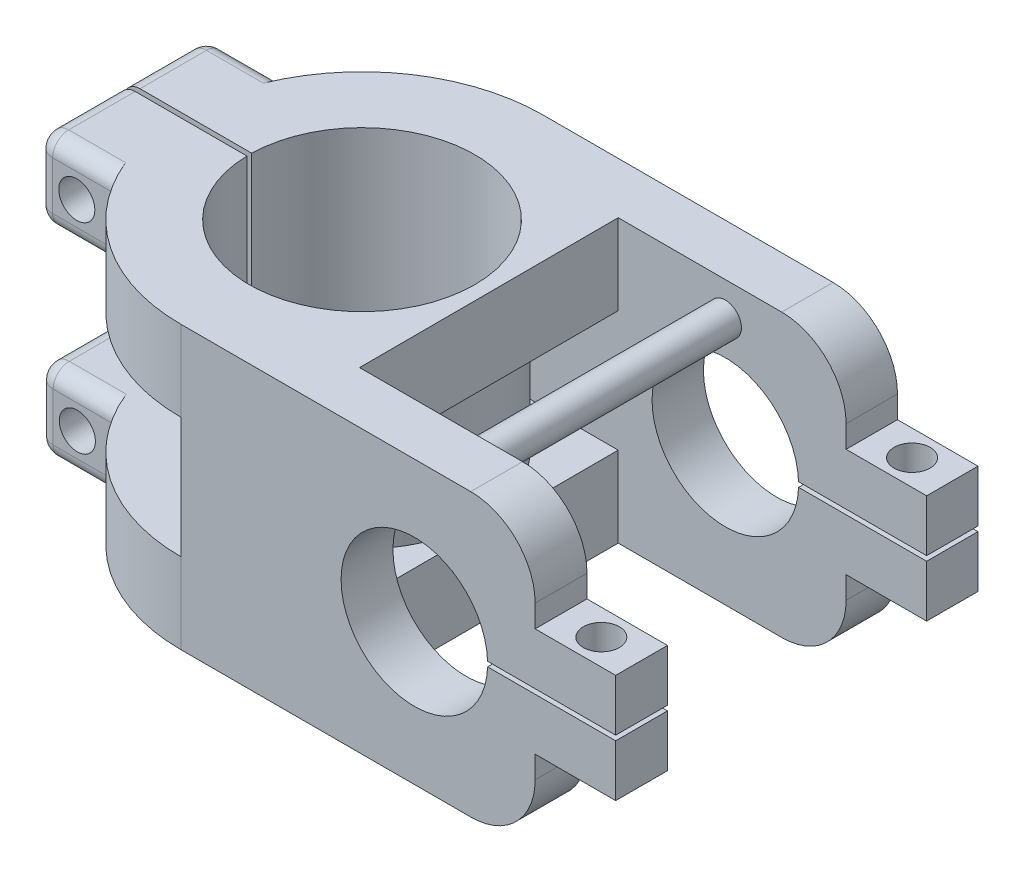
from build123d import *

# Parameters (mm, degrees)
SKETCH2_R                 = 28.575
SKETCH2_R_2               = 17.78
BOSS_EXTRUDE3_DEPTH       = 12.7
SKETCH3_W                 = 10.854473524
SKETCH3_H                 = 26.443507434
CUT_EXTRUDE1_DEPTH        = 12.7
CUT_EXTRUDE2_DEPTH        = 12.7
SKETCH5_W                 = 12.840753717
SKETCH5_H                 = 12.7
BOSS_EXTRUDE4_DEPTH       = 12.7
SKETCH6_W                 = 12.840753717
SKETCH6_H                 = 12.7
BOSS_EXTRUDE5_DEPTH       = 12.7
SKETCH7_R                 = 2.8448
CUT_EXTRUDE3_DEPTH        = 33.02
FILLET1_R                 = 2.54
FILLET2_R                 = 2.54
FILLET3_R                 = 2.54
FILLET4_R                 = 2.54
FILLET5_R                 = 2.54
FILLET6_R                 = 2.54
SKETCH8_R                 = 18.738819316
SKETCH8_R_2               = 17.78
BOSS_EXTRUDE6_DEPTH       = 19.05
SKETCH9_R                 = 28.575
BOSS_EXTRUDE7_DEPTH       = 12.7
SKETCH12_W                = 11.37566774
SKETCH12_H                = 26.806734356
CUT_EXTRUDE4_DEPTH        = 12.7
SKETCH13_W                = 26.806734356
SKETCH13_H                = 12.7
BOSS_EXTRUDE8_DEPTH       = 12.7
CUT_EXTRUDE5_START        = -12.7
SKETCH14_R                = 17.78
CUT_EXTRUDE5_DEPTH        = 12.7
CUT_EXTRUDE6_START        = -12.7
CUT_EXTRUDE6_DEPTH        = 12.7
SKETCH16_W                = 20.93971863
SKETCH16_H                = 0.381
CUT_EXTRUDE7_DEPTH        = 12.7
FILLET7_R                 = 2.54
FILLET8_R                 = 2.54
FILLET9_R                 = 2.54
FILLET10_R                = 2.54
FILLET11_R                = 2.54
FILLET12_R                = 2.54
SKETCH17_R                = 2.8448
CUT_EXTRUDE8_DEPTH        = 29.464
SKETCH19_W                = 1.827097527
SKETCH19_H                = 0.762
CUT_EXTRUDE13_DEPTH       = 29.464
BOSS_EXTRUDE12_DEPTH      = 31.75
BOSS_EXTRUDE12_DEPTH_BACK = 12.7
SKETCH22_W                = 55.88
SKETCH22_H                = 8.17709812
BOSS_EXTRUDE13_DEPTH      = 31.75
BOSS_EXTRUDE13_DEPTH_BACK = 12.7
SKETCH23_W                = 55.88
SKETCH23_H                = 8.104128776
SKETCH24_R                = 11.557
CUT_EXTRUDE14_DEPTH       = 67.31
FILLET13_R                = 10.16
FILLET14_R                = 10.16
FILLET15_R                = 10.16
FILLET16_R                = 10.16
CUT_EXTRUDE15_DEPTH       = 67.31
SKETCH26_R                = 2.54
BOSS_EXTRUDE14_DEPTH      = 43.434
SKETCH27_W                = 10.889060874
SKETCH27_H                = 0.381
CUT_EXTRUDE16_DEPTH       = 64.516
SKETCH28_W                = 8.900082699
SKETCH28_H                = 0.381
CUT_EXTRUDE17_DEPTH       = 64.516
SKETCH29_W                = 8.17709812
SKETCH29_H                = 8.1770982
BOSS_EXTRUDE15_DEPTH      = 12.7
SKETCH30_W                = 8.17709812
SKETCH30_H                = 8.1770982
BOSS_EXTRUDE16_DEPTH      = 12.7
SKETCH31_R                = 2.8448
CUT_EXTRUDE18_DEPTH       = 22.098
SKETCH34_W                = 8.104128776
SKETCH34_H                = 8.1770982
BOSS_EXTRUDE17_DEPTH      = 12.7
SKETCH35_W                = 8.104128776
SKETCH35_H                = 8.1770982
BOSS_EXTRUDE18_DEPTH      = 12.7
SKETCH36_R                = 2.8448
CUT_EXTRUDE19_DEPTH       = 27.686


with BuildPart() as part:
    # Sketch2 → Boss-Extrude3 (new body)
    with BuildSketch(Plane(origin=(0, 0, 0), x_dir=(1, 0, 0), z_dir=(0, 1, 0))):
        Circle(SKETCH2_R)
        Circle(SKETCH2_R_2, mode=Mode.SUBTRACT)
    extrude(amount=BOSS_EXTRUDE3_DEPTH)

    # Sketch3 → Cut-Extrude1 (cut)
    with BuildSketch(Plane(origin=(0, 12.7, 0), x_dir=(1, 0, 0), z_dir=(0, 1, 0))):
        with Locations((-30.759347879, 0)):
            Rectangle(SKETCH3_W, SKETCH3_H)
    extrude(amount=-CUT_EXTRUDE1_DEPTH, mode=Mode.SUBTRACT)

    # Sketch4 → Cut-Extrude2 (cut)
    with BuildSketch(Plane(origin=(0, 12.7, 0), x_dir=(1, 0, 0), z_dir=(0, 1, 0))):
        Polygon((-16.376768267, 0), (-16.376768267, 0.381), (-26.003615217, 0.381), (-26.003615217, -0.381), (-16.376768267, -0.381), align=None)
    extrude(amount=-CUT_EXTRUDE2_DEPTH, mode=Mode.SUBTRACT)

    # Sketch5 → Boss-Extrude4 (add)
    with BuildSketch(Plane.ZY.offset(25.332111117)):
        with Locations((6.801376859, 6.35)):
            Rectangle(SKETCH5_W, SKETCH5_H)
    extrude(amount=BOSS_EXTRUDE4_DEPTH)

    # Sketch6 → Boss-Extrude5 (add)
    with BuildSketch(Plane.ZY.offset(25.332111117)):
        with Locations((-6.801376859, 6.35)):
            Rectangle(SKETCH6_W, SKETCH6_H)
    extrude(amount=BOSS_EXTRUDE5_DEPTH)

    # Sketch7 → Cut-Extrude3 (cut)
    with BuildSketch(Plane.XY.offset(13.221753717)):
        with Locations((-31.682111117, 6.35)):
            Circle(SKETCH7_R)
    extrude(amount=-CUT_EXTRUDE3_DEPTH, mode=Mode.SUBTRACT)

    # Fillet1
    fillet1_edges = [part.edges().sort_by_distance(p)[0] for p in [
        (-38.032111117, 6.35, 13.221753717),
    ]]
    fillet(fillet1_edges, radius=FILLET1_R)

    # Fillet2
    fillet2_edges = [part.edges().sort_by_distance(p)[0] for p in [
        (-38.032111117, 6.35, -13.221753717),
    ]]
    fillet(fillet2_edges, radius=FILLET2_R)

    # Fillet3
    fillet3_edges = [part.edges().sort_by_distance(p)[0] for p in [
        (-30.412111117, 12.7, -13.221753717),
        (-37.288162341, 12.7, -12.477804942),
        (-38.032111117, 12.7, -5.531376859),
    ]]
    fillet(fillet3_edges, radius=FILLET3_R)

    # Fillet4
    fillet4_edges = [part.edges().sort_by_distance(p)[0] for p in [
        (-30.412111117, 12.7, 13.221753717),
        (-37.288162341, 12.7, 12.477804942),
        (-38.032111117, 12.7, 5.531376859),
    ]]
    fillet(fillet4_edges, radius=FILLET4_R)

    # Fillet5
    fillet5_edges = [part.edges().sort_by_distance(p)[0] for p in [
        (-30.412111117, 0, -13.221753717),
        (-37.288162341, 0, -12.477804942),
        (-38.032111117, 0, -5.531376859),
    ]]
    fillet(fillet5_edges, radius=FILLET5_R)

    # Fillet6
    fillet6_edges = [part.edges().sort_by_distance(p)[0] for p in [
        (-30.412111117, 0, 13.221753717),
        (-37.288162341, 0, 12.477804942),
        (-38.032111117, 0, 5.531376859),
    ]]
    fillet(fillet6_edges, radius=FILLET6_R)

    # Sketch8 → Boss-Extrude6 (add)
    with BuildSketch(Plane(origin=(0, 12.7, 0), x_dir=(1, 0, 0), z_dir=(0, 1, 0))):
        Circle(SKETCH8_R)
        Circle(SKETCH8_R_2, mode=Mode.SUBTRACT)
    extrude(amount=BOSS_EXTRUDE6_DEPTH)

    # Sketch9 → Boss-Extrude7 (add)
    with BuildSketch(Plane(origin=(0, 31.75, 0), x_dir=(1, 0, 0), z_dir=(0, 1, 0))):
        Circle(SKETCH9_R)
    extrude(amount=BOSS_EXTRUDE7_DEPTH)

    # Sketch12 → Cut-Extrude4 (cut)
    with BuildSketch(Plane(origin=(0, 44.45, 0), x_dir=(1, 0, 0), z_dir=(0, 1, 0))):
        with Locations((-30.924322796, 0)):
            Rectangle(SKETCH12_W, SKETCH12_H)
    extrude(amount=-CUT_EXTRUDE4_DEPTH, mode=Mode.SUBTRACT)

    # Sketch13 → Boss-Extrude8 (add)
    with BuildSketch(Plane.ZY.offset(25.236488926)):
        with Locations((0, 38.1)):
            Rectangle(SKETCH13_W, SKETCH13_H)
    extrude(amount=BOSS_EXTRUDE8_DEPTH)

    # Sketch14 → Cut-Extrude5 (cut)
    with BuildSketch(Plane(origin=(0, 44.45, 0), x_dir=(1, 0, 0), z_dir=(0, 1, 0)).offset(CUT_EXTRUDE5_START)):
        Circle(SKETCH14_R)
    extrude(amount=CUT_EXTRUDE5_DEPTH, mode=Mode.SUBTRACT)

    # Sketch15 → Cut-Extrude6 (cut)
    with BuildSketch(Plane(origin=(0, 44.45, 0), x_dir=(1, 0, 0), z_dir=(0, 1, 0)).offset(CUT_EXTRUDE6_START)):
        with BuildLine():
            Line((-37.936488926, 0.381), (-37.936488926, 0))
            Line((-37.936488926, 0), (-17.78, 0))
            ThreePointArc((-17.78, 0), (-17.778979318, 0.190510937), (-17.775917388, 0.381))
            Line((-17.775917388, 0.381), (-37.936488926, 0.381))
        make_face()
    extrude(amount=CUT_EXTRUDE6_DEPTH, mode=Mode.SUBTRACT)

    # Sketch16 → Cut-Extrude7 (cut)
    with BuildSketch(Plane(origin=(0, 44.45, 0), x_dir=(1, 0, 0), z_dir=(0, 1, 0))):
        with Locations((-27.466629611, -0.1905)):
            Rectangle(SKETCH16_W, SKETCH16_H)
    extrude(amount=-CUT_EXTRUDE7_DEPTH, mode=Mode.SUBTRACT)

    # Fillet7
    fillet7_edges = [part.edges().sort_by_distance(p)[0] for p in [
        (-37.936488926, 44.45, -6.892183589),
    ]]
    fillet(fillet7_edges, radius=FILLET7_R)

    # Fillet8
    fillet8_edges = [part.edges().sort_by_distance(p)[0] for p in [
        (-37.936488926, 44.45, 6.892183589),
    ]]
    fillet(fillet8_edges, radius=FILLET8_R)

    # Fillet9
    fillet9_edges = [part.edges().sort_by_distance(p)[0] for p in [
        (-37.936488926, 31.75, -6.892183589),
    ]]
    fillet(fillet9_edges, radius=FILLET9_R)

    # Fillet10
    fillet10_edges = [part.edges().sort_by_distance(p)[0] for p in [
        (-37.936488926, 31.75, 6.892183589),
    ]]
    fillet(fillet10_edges, radius=FILLET10_R)

    # Fillet11
    fillet11_edges = [part.edges().sort_by_distance(p)[0] for p in [
        (-30.316488926, 31.75, 13.403367178),
        (-37.19254015, 32.493948776, 13.403367178),
        (-30.316488926, 44.45, 13.403367178),
        (-37.19254015, 43.706051224, 13.403367178),
        (-37.936488926, 38.1, 13.403367178),
    ]]
    fillet(fillet11_edges, radius=FILLET11_R)

    # Fillet12
    fillet12_edges = [part.edges().sort_by_distance(p)[0] for p in [
        (-30.316488926, 44.45, -13.403367178),
        (-37.19254015, 43.706051224, -13.403367178),
        (-30.316488926, 31.75, -13.403367178),
        (-37.19254015, 32.493948776, -13.403367178),
        (-37.936488926, 38.1, -13.403367178),
    ]]
    fillet(fillet12_edges, radius=FILLET12_R)

    # Sketch17 → Cut-Extrude8 (cut)
    with BuildSketch(Plane.XY.offset(13.403367178)):
        with Locations((-31.586488926, 38.1)):
            Circle(SKETCH17_R)
    extrude(amount=-CUT_EXTRUDE8_DEPTH, mode=Mode.SUBTRACT)

    # Sketch19 → Cut-Extrude13 (cut)
    with BuildSketch(Plane(origin=(0, 31.75, 0), x_dir=(1, 0, 0), z_dir=(0, 1, 0))):
        with Locations((-17.821396883, 0)):
            Rectangle(SKETCH19_W, SKETCH19_H)
    extrude(amount=-CUT_EXTRUDE13_DEPTH, mode=Mode.SUBTRACT)


with BuildPart() as cut_extrude13_kept_piece:
    # of the separate pieces the step leaves, the one the design keeps (cut_extrude13_pieces_kept)
    add(part.part.solids().sort_by_distance((-35.396488926, 31.75, -10.863367178))[0])

    # Sketch22 → Boss-Extrude12 (add, two sides: drawn at the far end of the back side and taken through both)
    with BuildSketch(Plane(origin=(0, 12.7, 0), x_dir=(1, 0, 0), z_dir=(0, 1, 0)).offset(-BOSS_EXTRUDE12_DEPTH_BACK)):
        with Locations((27.94, -24.48645094)):
            Rectangle(SKETCH22_W, SKETCH22_H)
    extrude(amount=BOSS_EXTRUDE12_DEPTH + BOSS_EXTRUDE12_DEPTH_BACK)

    # Sketch23 → Boss-Extrude13 (add, two sides: drawn at the far end of the back side and taken through both)
    with BuildSketch(Plane(origin=(0, 12.7, 0), x_dir=(1, 0, 0), z_dir=(0, 1, 0)).offset(-BOSS_EXTRUDE13_DEPTH_BACK)):
        with Locations((27.94, 24.522935612)):
            Rectangle(SKETCH23_W, SKETCH23_H)
    extrude(amount=BOSS_EXTRUDE13_DEPTH + BOSS_EXTRUDE13_DEPTH_BACK)

    # Sketch24 → Cut-Extrude14 (cut)
    with BuildSketch(Plane(origin=(0, 0, -28.575), x_dir=(-1, 0, 0), z_dir=(0, 0, -1))):
        with Locations((-36.83, 22.225)):
            Circle(SKETCH24_R)
    extrude(amount=-CUT_EXTRUDE14_DEPTH, mode=Mode.SUBTRACT)

    # Fillet13
    fillet13_edges = [cut_extrude13_kept_piece.edges().sort_by_distance(p)[0] for p in [
        (55.88, 44.45, 24.48645094),
    ]]
    fillet(fillet13_edges, radius=FILLET13_R)

    # Fillet14
    fillet14_edges = [cut_extrude13_kept_piece.edges().sort_by_distance(p)[0] for p in [
        (55.88, 0, 24.48645094),
    ]]
    fillet(fillet14_edges, radius=FILLET14_R)

    # Fillet15
    fillet15_edges = [cut_extrude13_kept_piece.edges().sort_by_distance(p)[0] for p in [
        (55.88, 44.45, -24.522935612),
    ]]
    fillet(fillet15_edges, radius=FILLET15_R)

    # Fillet16
    fillet16_edges = [cut_extrude13_kept_piece.edges().sort_by_distance(p)[0] for p in [
        (55.88, 0, -24.522935612),
    ]]
    fillet(fillet16_edges, radius=FILLET16_R)

    # Sketch25 → Cut-Extrude15 (cut)
    with BuildSketch(Plane(origin=(0, 44.45, 0), x_dir=(1, 0, 0), z_dir=(0, 1, 0))):
        Polygon((28.57495233, 0.052195041), (28.57495233, 20.470871224), (19.936751399, 20.470871224), (20.011402347, -20.39790188), (28.575, -20.39790188), align=None)
    extrude(amount=-CUT_EXTRUDE15_DEPTH, mode=Mode.SUBTRACT)


with BuildPart() as body_2:
    # of the pieces the cut leaves, the one that is kept (cut_extrude15_keep)
    add(cut_extrude13_kept_piece.part.solids().sort_by_distance((55.88, 10.16, -20.470871224))[0])

    # Sketch26 → Boss-Extrude14 (add)
    with BuildSketch(Plane.XY.offset(-20.470871224)):
        with Locations((36.83, 39.116)):
            Circle(SKETCH26_R)
    extrude(amount=BOSS_EXTRUDE14_DEPTH)

    # Sketch27 → Cut-Extrude16 (cut)
    with BuildSketch(Plane.XY.offset(28.575)):
        with Locations((52.414940452, 22.4155)):
            Rectangle(SKETCH27_W, SKETCH27_H)
    extrude(amount=-CUT_EXTRUDE16_DEPTH, mode=Mode.SUBTRACT)

    # Sketch28 → Cut-Extrude17 (cut)
    with BuildSketch(Plane.XY.offset(28.575)):
        with Locations((52.021010234, 22.0345)):
            Rectangle(SKETCH28_W, SKETCH28_H)
    extrude(amount=-CUT_EXTRUDE17_DEPTH, mode=Mode.SUBTRACT)

    # Sketch29 → Boss-Extrude15 (add)
    with BuildSketch(Plane(origin=(55.88, 0, 0), x_dir=(0, 0, -1), z_dir=(1, 0, 0))):
        with Locations((-24.48645094, 26.6945491)):
            Rectangle(SKETCH29_W, SKETCH29_H)
    extrude(amount=BOSS_EXTRUDE15_DEPTH)

    # Sketch30 → Boss-Extrude16 (add)
    with BuildSketch(Plane(origin=(55.88, 0, 0), x_dir=(0, 0, -1), z_dir=(1, 0, 0))):
        with Locations((-24.48645094, 17.7554509)):
            Rectangle(SKETCH30_W, SKETCH30_H)
    extrude(amount=BOSS_EXTRUDE16_DEPTH)

    # Sketch31 → Cut-Extrude18 (cut)
    with BuildSketch(Plane(origin=(0, 30.7830982, 0), x_dir=(1, 0, 0), z_dir=(0, 1, 0))):
        with Locations((62.23, -24.48645094)):
            Circle(SKETCH31_R)
    extrude(amount=-CUT_EXTRUDE18_DEPTH, mode=Mode.SUBTRACT)

    # Sketch34 → Boss-Extrude17 (add)
    with BuildSketch(Plane(origin=(55.88, 0, 0), x_dir=(0, 0, -1), z_dir=(1, 0, 0))):
        with Locations((24.522935612, 26.6945491)):
            Rectangle(SKETCH34_W, SKETCH34_H)
    extrude(amount=BOSS_EXTRUDE17_DEPTH)

    # Sketch35 → Boss-Extrude18 (add)
    with BuildSketch(Plane(origin=(55.88, 0, 0), x_dir=(0, 0, -1), z_dir=(1, 0, 0))):
        with Locations((24.522935612, 17.7554509)):
            Rectangle(SKETCH35_W, SKETCH35_H)
    extrude(amount=BOSS_EXTRUDE18_DEPTH)

    # Sketch36 → Cut-Extrude19 (cut)
    with BuildSketch(Plane(origin=(0, 30.7830982, 0), x_dir=(1, 0, 0), z_dir=(0, 1, 0))):
        with Locations((62.23, 24.522935612)):
            Circle(SKETCH36_R)
    extrude(amount=-CUT_EXTRUDE19_DEPTH, mode=Mode.SUBTRACT)


solid = body_2.part
